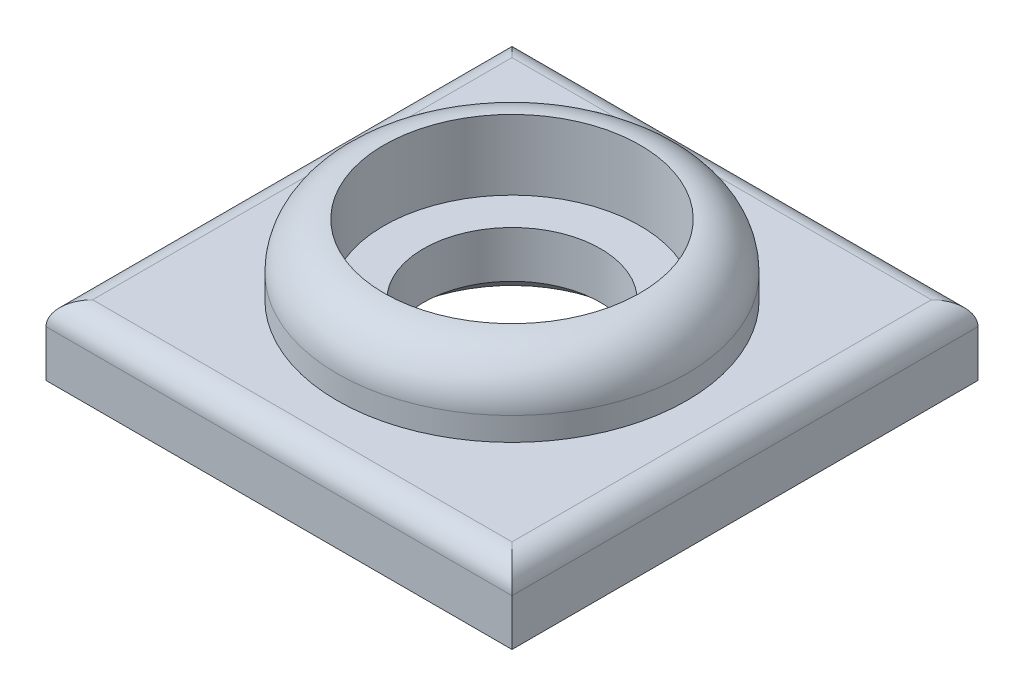
from build123d import *

# Parameters (mm, degrees)
SKETCH1_W           = 20
SKETCH1_H           = 20
SKETCH1_R           = 3.8
BOSS_EXTRUDE1_DEPTH = 3
FILLET1_R           = 1
CHAMFER1_SIZE       = 1
CHAMFER1_SIZE2      = 1.191753593
SKETCH2_R           = 7.5
SKETCH2_R_2         = 5.5
BOSS_EXTRUDE2_DEPTH = 3
FILLET2_R           = 2


with BuildPart() as part:
    # Sketch1 → Boss-Extrude1 (new body)
    with BuildSketch(Plane(origin=(0, 0, 0), x_dir=(1, 0, 0), z_dir=(0, 1, 0))):
        Rectangle(SKETCH1_W, SKETCH1_H)
        with Locations(Location((0, 0, 0), (0, 0, 270))):
            Circle(SKETCH1_R, mode=Mode.SUBTRACT)
    extrude(amount=BOSS_EXTRUDE1_DEPTH)

    # Fillet1
    fillet1_edges = [part.edges().sort_by_distance(p)[0] for p in [
        (10, 3, 0),
        (0, 3, -10),
        (-10, 3, 0),
        (0, 3, 10),
    ]]
    fillet(fillet1_edges, radius=FILLET1_R)

    # Chamfer1
    chamfer1_edges = [part.edges().sort_by_distance(p)[0] for p in [
        (0, 0, -3.8),
    ]]
    chamfer1_side = [part.faces().sort_by_distance(p)[0] for p in [
        (0, 1.5, -3.8),
    ]]
    chamfer(chamfer1_edges, length=CHAMFER1_SIZE, length2=CHAMFER1_SIZE2, reference=chamfer1_side[0])

    # Sketch2 → Boss-Extrude2 (add)
    with BuildSketch(Plane(origin=(0, 3, 0), x_dir=(1, 0, 0), z_dir=(0, 1, 0))):
        with Locations(Location((0, 0, 0), (0, 0, 270))):
            Circle(SKETCH2_R)
        with Locations(Location((0, 0, 0), (0, 0, 270))):
            Circle(SKETCH2_R_2, mode=Mode.SUBTRACT)
    extrude(amount=BOSS_EXTRUDE2_DEPTH)

    # Fillet2
    fillet2_edges = [part.edges().sort_by_distance(p)[0] for p in [
        (0, 6, -7.5),
    ]]
    fillet(fillet2_edges, radius=FILLET2_R - 0.0001)  # a hair under: the kernel refuses the full size


solid = part.part
